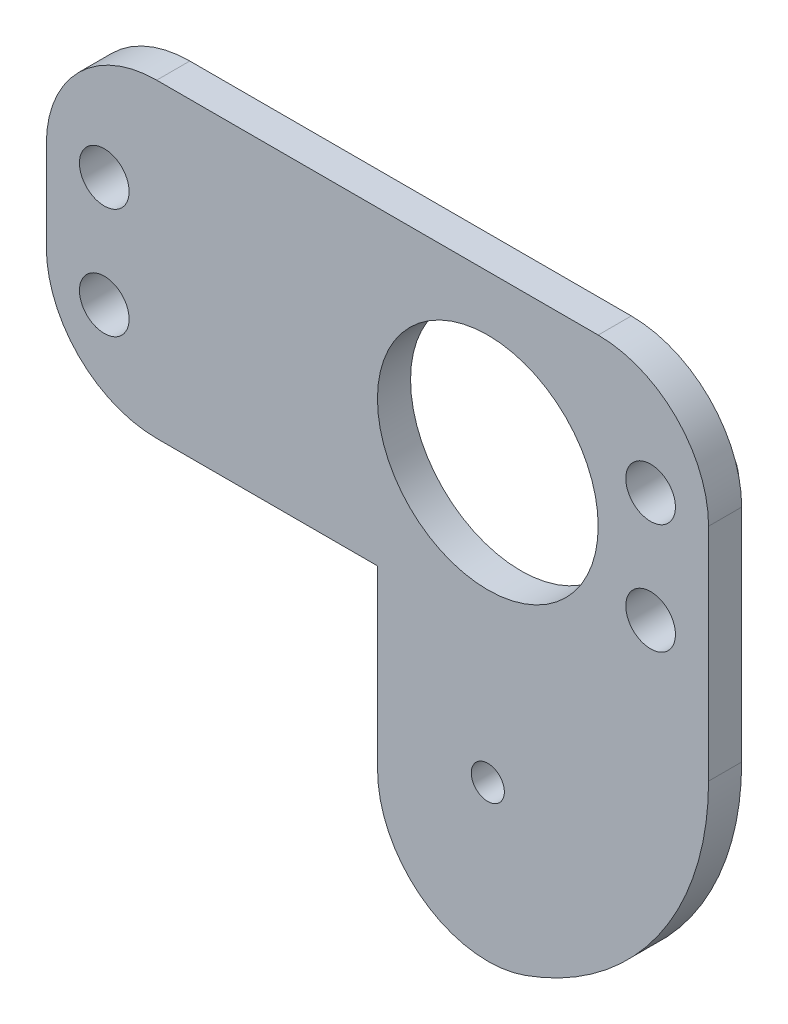
from build123d import *

# Parameters (mm, degrees)
SKETCH_3_R               = 3
EXTRUDE_6_DEPTH          = 2
EXTRUDE_6_2_DEPTH        = 2
EXTRUDE_6_3_DEPTH        = 2
EXTRUDE_6_4_DEPTH        = 2
CUT_EXTRUDE_2_DEPTH      = 10
CUT_EXTRUDE_2_DEPTH_BACK = 2
SKETCH_11_R              = 2.25
SKETCH_12_W              = 60
SKETCH_12_H              = 55
EXTRUDE_7_DEPTH          = 3
CUT_EXTRUDE_START        = -3
SKETCH_14_R              = 2.25
SKETCH_14_R_2            = 10
CUT_EXTRUDE_3_DEPTH      = 3
SKETCH_15_R              = 10
SKETCH_15_R_2            = 1.5
CUT_EXTRUDE_4_DEPTH      = 3
FILLET_3_R               = 25
FILLET_4_R               = 10
SKETCH_16_W              = 30.01414915
SKETCH_16_H              = 26.889231784
CUT_EXTRUDE_5_DEPTH      = 10
FILLET_6_R               = 10


with BuildPart() as part:
    # 草图3 → 凸台-拉伸6 (new body)
    with BuildSketch(Plane.XY):
        with Locations((60.266478541, 16.532501821)):
            Circle(SKETCH_3_R)
    extrude(amount=EXTRUDE_6_DEPTH)


with BuildPart() as body_2:
    # 草图3 → Extrude 6 2 (new body)
    with BuildSketch(Plane.XY):
        with Locations((60.266478541, 6.532501821)):
            Circle(SKETCH_3_R)
    extrude(amount=EXTRUDE_6_2_DEPTH)


with BuildPart() as body_3:
    # 草图3 → Extrude 6 3 (new body)
    with BuildSketch(Plane.XY):
        with Locations((10.766478541, 6.532501821)):
            Circle(SKETCH_3_R)
    extrude(amount=EXTRUDE_6_3_DEPTH)


with BuildPart() as body_4:
    # 草图3 → Extrude 6 4 (new body)
    with BuildSketch(Plane.XY):
        with Locations((10.766478541, 16.532501821)):
            Circle(SKETCH_3_R)
    extrude(amount=EXTRUDE_6_4_DEPTH)


with BuildPart() as cut_extrude_2_tool:
    # 草图11 → 切除-拉伸2 (new, two sides: drawn at the far end of the back side and taken through both)
    with BuildSketch(Plane.XY.offset(2).offset(-CUT_EXTRUDE_2_DEPTH_BACK)):
        with Locations((10.766478541, 16.532501821)):
            Circle(SKETCH_11_R)
        with Locations((10.766478541, 6.532501821)):
            Circle(SKETCH_11_R)
        with Locations((60.266478541, 16.532501821)):
            Circle(SKETCH_11_R)
        with Locations((60.266478541, 6.532501821)):
            Circle(SKETCH_11_R)
    extrude(amount=CUT_EXTRUDE_2_DEPTH + CUT_EXTRUDE_2_DEPTH_BACK)


with BuildPart() as part_1:
    add(part.part)

    # 切除-拉伸2: cut by cut_extrude_2_tool
    add(cut_extrude_2_tool.part, mode=Mode.SUBTRACT)



with BuildPart() as body_2_1:
    add(body_2.part)

    # 切除-拉伸2: cut by cut_extrude_2_tool
    add(cut_extrude_2_tool.part, mode=Mode.SUBTRACT)


with BuildPart() as body_3_1:
    add(body_3.part)

    # 切除-拉伸2: cut by cut_extrude_2_tool
    add(cut_extrude_2_tool.part, mode=Mode.SUBTRACT)


with BuildPart() as body_4_1:
    add(body_4.part)

    # 切除-拉伸2: cut by cut_extrude_2_tool
    add(cut_extrude_2_tool.part, mode=Mode.SUBTRACT)


with BuildPart() as part_2:
    add(part_1.part)

    add(body_2_1.part)  # 凸台-拉伸7 merges body 2

    add(body_3_1.part)  # 凸台-拉伸7 merges body 3

    add(body_4_1.part)  # 凸台-拉伸7 merges body 4
    # 草图12 → 凸台-拉伸7 (add)
    with BuildSketch(Plane.XY.offset(2)):
        with Locations((35.516478541, -0.967498179)):
            Rectangle(SKETCH_12_W, SKETCH_12_H)
    extrude(amount=EXTRUDE_7_DEPTH)

    # 草图14 → 切除-拉伸3 (cut)
    with BuildSketch(Plane(origin=(0, 0, 2), x_dir=(-1, 0, 0), z_dir=(0, 0, -1)).offset(CUT_EXTRUDE_START)):
        with Locations((-60.266478541, 6.532501821)):
            Circle(SKETCH_14_R)
        with Locations((-60.266478541, 16.532501821)):
            Circle(SKETCH_14_R)
        with Locations((-10.766478541, 6.532501821)):
            Circle(SKETCH_14_R)
        with Locations((-10.766478541, 16.532501821)):
            Circle(SKETCH_14_R)
        with Locations((-45.516478541, 11.532501821)):
            Circle(SKETCH_14_R_2)
    extrude(amount=CUT_EXTRUDE_3_DEPTH, mode=Mode.SUBTRACT)

    # 草图15 → 切除-拉伸4 (cut)
    with BuildSketch(Plane(origin=(0, 0, 2), x_dir=(-1, 0, 0), z_dir=(0, 0, -1)).offset(CUT_EXTRUDE_START)):
        with Locations((-45.516478541, 11.532501821)):
            Circle(SKETCH_15_R)
        with Locations((-45.516478541, -13.567498179)):
            Circle(SKETCH_15_R_2)
    extrude(amount=CUT_EXTRUDE_4_DEPTH, mode=Mode.SUBTRACT)

    # 圆角3
    fillet_3_edges = [part_2.edges().sort_by_distance(p)[0] for p in [
        (65.516478541, -28.467498179, 3.5),
    ]]
    fillet(fillet_3_edges, radius=FILLET_3_R)

    # 圆角4
    fillet_4_edges = [part_2.edges().sort_by_distance(p)[0] for p in [
        (65.516478541, 26.532501821, 3.5),
        (5.516478541, 26.532501821, 3.5),
    ]]
    fillet(fillet_4_edges, radius=FILLET_4_R)

    # 草图16 → 切除-拉伸5 (cut)
    with BuildSketch(Plane.XY.offset(5)):
        with Locations((20.523553116, -15.022882287)):
            Rectangle(SKETCH_16_W, SKETCH_16_H)
    extrude(amount=-CUT_EXTRUDE_5_DEPTH, mode=Mode.SUBTRACT)

    # 圆角6
    fillet_6_edges = [part_2.edges().sort_by_distance(p)[0] for p in [
        (5.516478541, -1.578266395, 3.5),
        (35.530627691, -28.467498179, 3.5),
    ]]
    fillet(fillet_6_edges, radius=FILLET_6_R)


solid = part_2.part
